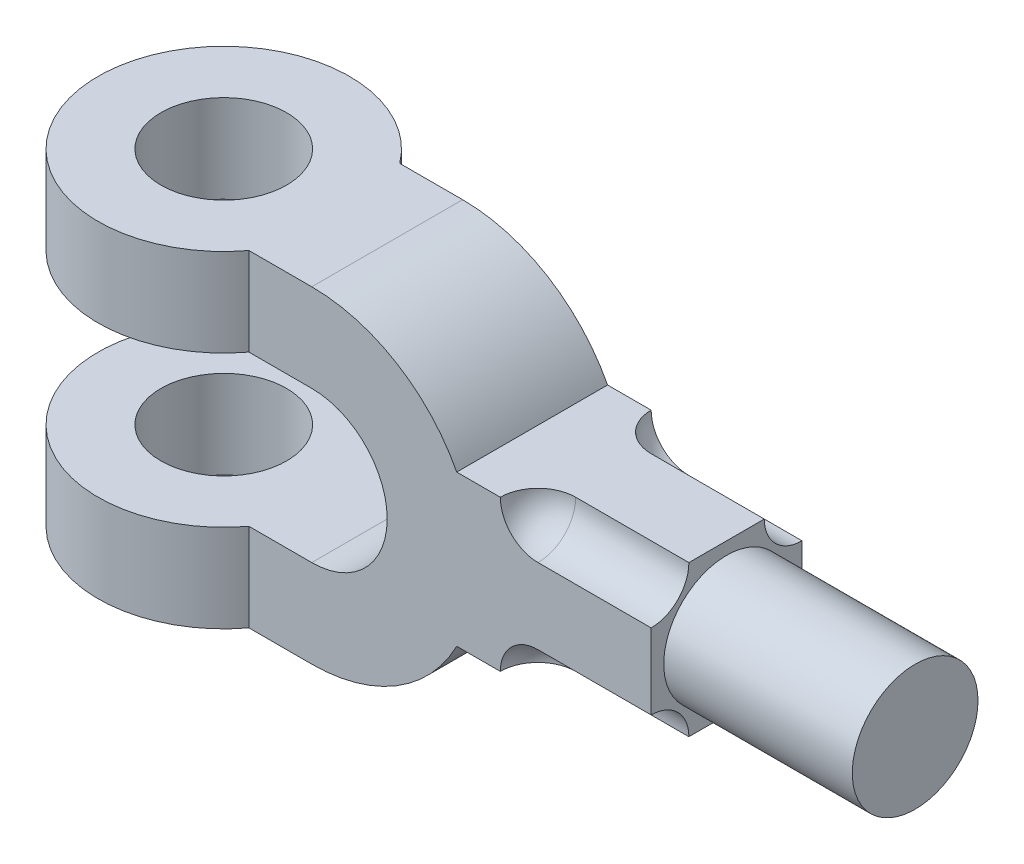
from build123d import *

# Parameters (mm, degrees)
SKETCH1_R               = 20
BOSS_EXTRUDE1_DEPTH     = 52
CUT_EXTRUDE1_DEPTH      = 60.194594348
CUT_EXTRUDE1_DEPTH_BACK = 60.194594348
SKETCH2_R               = 10
BOSS_EXTRUDE8_DEPTH     = 12
SKETCH7_R               = 10
BOSS_EXTRUDE9_DEPTH     = 30
CUT_EXTRUDE2_DEPTH      = 115.47270417
CUT_EXTRUDE2_DEPTH_BACK = 24
SKETCH9_R               = 6
FILLET1_R               = 6
CUT_EXTRUDE3_DEPTH      = 124.304501177
CUT_EXTRUDE3_DEPTH_BACK = 124.304501177
SKETCH11_W              = 42.326213612
SKETCH11_H              = 24


with BuildPart() as part:
    # Sketch1 → Boss-Extrude1 (new body)
    with BuildSketch(Plane(origin=(0, 0, 0), x_dir=(1, 0, 0), z_dir=(0, 1, 0))):
        with Locations(Location((0, 0, 0), (0, 0, 90))):
            Circle(SKETCH1_R)
    extrude(amount=BOSS_EXTRUDE1_DEPTH)

    # Sketch2 → Cut-Extrude1 (cut, two sides: drawn at the far end of the back side and taken through both)
    with BuildSketch(Plane(origin=(0, 52, 0), x_dir=(1, 0, 0), z_dir=(0, 1, 0)).offset(-CUT_EXTRUDE1_DEPTH_BACK)):
        with Locations(Location((0, 0, 0), (0, 0, 270))):
            Circle(SKETCH2_R)
    extrude(amount=CUT_EXTRUDE1_DEPTH + CUT_EXTRUDE1_DEPTH_BACK, mode=Mode.SUBTRACT)

    # Sketch5 → Boss-Extrude8 (add, symmetric)
    with BuildSketch(Plane.XY):
        with BuildLine():
            Line((26, 0), (16, 0))
            Line((16, 0), (16, 14))
            Line((16, 14), (26, 14))
            ThreePointArc((26, 14), (38, 26), (26, 38))
            Line((26, 38), (16, 38))
            Line((16, 38), (16, 52))
            Line((16, 52), (26, 52))
            ThreePointArc((26, 52), (39.490737563, 48.226110771), (49.065125189, 38))
            Line((49.065125189, 38), (80, 38))
            Line((80, 38), (80, 14))
            Line((80, 14), (49.065125189, 14))
            ThreePointArc((49.065125189, 14), (39.490737563, 3.773889229), (26, 0))
        make_face()
    extrude(amount=BOSS_EXTRUDE8_DEPTH, both=True)

    # Sketch7 → Boss-Extrude9 (add)
    with BuildSketch(Plane(origin=(80, 0, 0), x_dir=(0, 0, -1), z_dir=(1, 0, 0))):
        with Locations((0, 26)):
            Circle(SKETCH7_R)
    extrude(amount=BOSS_EXTRUDE9_DEPTH)

    # Sketch9 → Cut-Extrude2 (cut, two sides: drawn at the far end of the back side and taken through both)
    with BuildSketch(Plane(origin=(80, 0, 0), x_dir=(0, 0, -1), z_dir=(1, 0, 0)).offset(-CUT_EXTRUDE2_DEPTH_BACK)):
        with Locations((-12, 38)):
            Circle(SKETCH9_R)
        with Locations((12, 38)):
            Circle(SKETCH9_R)
        with Locations((12, 14)):
            Circle(SKETCH9_R)
        with Locations((-12, 14)):
            Circle(SKETCH9_R)
    extrude(amount=CUT_EXTRUDE2_DEPTH + CUT_EXTRUDE2_DEPTH_BACK, mode=Mode.SUBTRACT)

    # Fillet1
    fillet1_edges = [part.edges().sort_by_distance(p)[0] for p in [
        (56, 18.242640687, -7.757359313),
        (56, 18.242640687, 7.757359313),
        (56, 33.757359313, -7.757359313),
        (56, 33.757359313, 7.757359313),
    ]]
    fillet(fillet1_edges, radius=FILLET1_R - 0.0001)  # a hair under: the kernel refuses the full size

    # Sketch11 → Cut-Extrude3 (cut, two sides: drawn at the far end of the back side and taken through both)
    with BuildSketch(Plane.XY.offset(-CUT_EXTRUDE3_DEPTH_BACK)):
        with Locations((0, 26)):
            Rectangle(SKETCH11_W, SKETCH11_H)
    extrude(amount=CUT_EXTRUDE3_DEPTH + CUT_EXTRUDE3_DEPTH_BACK, mode=Mode.SUBTRACT)


solid = part.part
